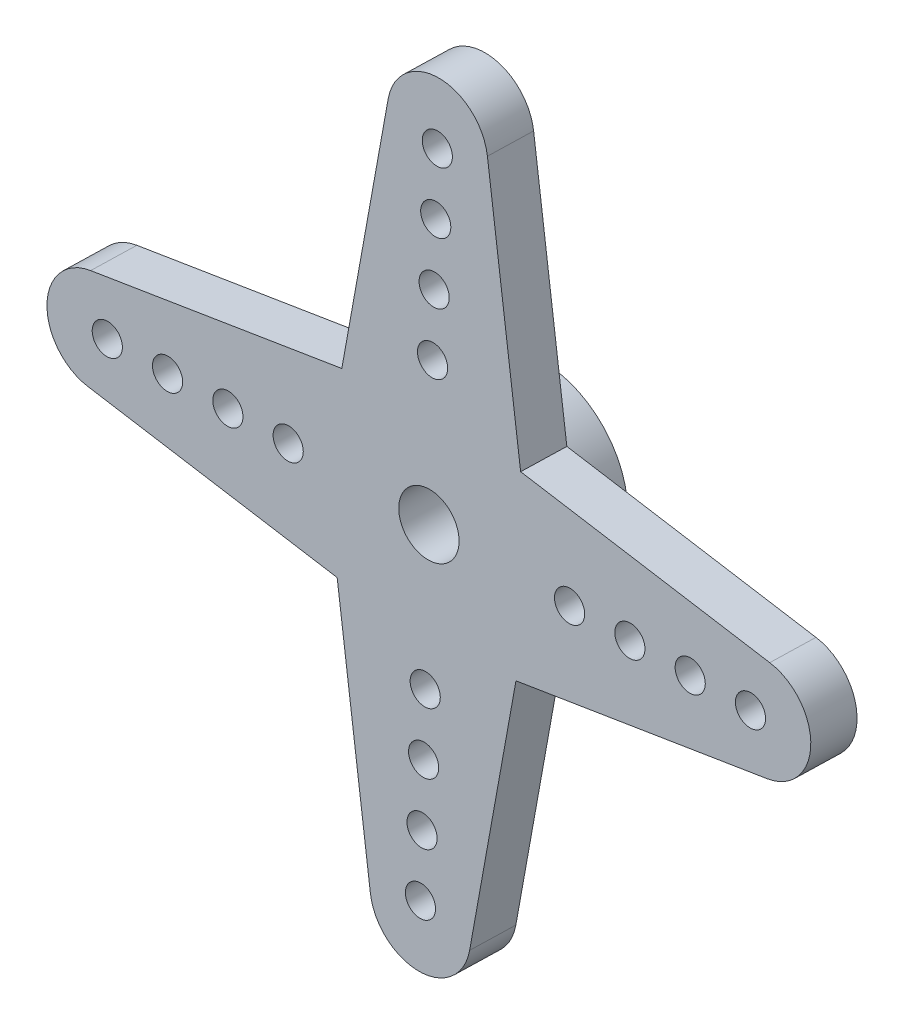
from build123d import *

# Parameters (mm, degrees)
SKETCH1_R                     = 6.1
SKETCH1_R_2                   = 1.5
BOSS_EXTRUDE1_DEPTH           = 2.3
SKETCH2_R                     = 4.4
SKETCH2_R_2                   = 3
BOSS_EXTRUDE2_DEPTH           = 3.2
BOSS_EXTRUDE3_DEPTH           = 2.3
CIRPATTERN1_COUNT             = 4
BODY_MOVE_COPY1_START         = -18.993489175
BODY_MOVE_COPY1_OUTLINE_W     = 40
BODY_MOVE_COPY1_OUTLINE_H     = 41
BODY_MOVE_COPY1_OUTLINE_R     = 0.75
BODY_MOVE_COPY1_OUTLINE_R_2   = 4.4
BODY_MOVE_COPY1_OUTLINE_R_3   = 3
BODY_MOVE_COPY1_DEPTH         = 19.515475783
BODY_MOVE_COPY1_START_2       = 2.821986608
BODY_MOVE_COPY1_2_OUTLINE_R   = 0.75
BODY_MOVE_COPY1_2_DEPTH       = 16.231709548
BODY_MOVE_COPY1_START_3       = 0.521986608
BODY_MOVE_COPY1_3_OUTLINE_W   = 40
BODY_MOVE_COPY1_3_OUTLINE_H   = 41
BODY_MOVE_COPY1_3_OUTLINE_R   = 0.75
BODY_MOVE_COPY1_3_OUTLINE_R_2 = 1.5
BODY_MOVE_COPY1_3_DEPTH       = 2.3
BODY_MOVE_COPY1_START_4       = -18.933282193
BODY_MOVE_COPY1_4_OUTLINE_R   = 4.4
BODY_MOVE_COPY1_4_OUTLINE_R_2 = 3
BODY_MOVE_COPY1_4_DEPTH       = 16.255268801
BODY_MOVE_COPY1_5_OUTLINE_R   = 0.75
BODY_MOVE_COPY1_5_OUTLINE_R_2 = 1.5
BODY_MOVE_COPY1_5_DEPTH       = 2.3
BODY_MOVE_COPY1_START_5       = -2.678013392
BODY_MOVE_COPY1_6_OUTLINE_R   = 4.4
BODY_MOVE_COPY1_6_OUTLINE_R_2 = 3
BODY_MOVE_COPY1_6_DEPTH       = 3.2


# Read off the part's stored shape, not the designer's step: Body-Move/Copy1
with BuildPart() as part:
    # Sketch1 → Boss-Extrude1 (new body)
    with BuildSketch(Plane(origin=(0, 0, 0), x_dir=(1, 0, 0), z_dir=(0, 1, 0))):
        with Locations(Location((0, 0, 0), (0, 0, 270))):
            Circle(SKETCH1_R)
        with Locations(Location((0, 0, 0), (0, 0, 270))):
            Circle(SKETCH1_R_2, mode=Mode.SUBTRACT)
    extrude(amount=BOSS_EXTRUDE1_DEPTH)

    # Sketch2 → Boss-Extrude2 (add)
    with BuildSketch(Plane(origin=(0, 2.3, 0), x_dir=(1, 0, 0), z_dir=(0, 1, 0))):
        with Locations(Location((0, 0, 0), (0, 0, 270))):
            Circle(SKETCH2_R)
        with Locations(Location((0, 0, 0), (0, 0, 270))):
            Circle(SKETCH2_R_2, mode=Mode.SUBTRACT)
    extrude(amount=BOSS_EXTRUDE2_DEPTH)

    # Sketch3 → Boss-Extrude3 (add)
    with BuildSketch(Plane.XZ):
        with BuildLine():
            ThreePointArc((4.5, -4.118252056), (2.458522163, -5.582622034), (0, -6.1))
            Line((0, -6.1), (0, -6.25))
            ThreePointArc((0, -6.25), (0.530330086, -6.469669914), (0.75, -7))
            ThreePointArc((0.75, -7), (0.530330086, -7.530330086), (0, -7.75))
            Line((0, -7.75), (0, -9.25))
            ThreePointArc((0, -9.25), (0.530330086, -9.469669914), (0.75, -10))
            ThreePointArc((0.75, -10), (0.530330086, -10.530330086), (0, -10.75))
            Line((0, -10.75), (0, -12.25))
            ThreePointArc((0, -12.25), (0.530330086, -12.469669914), (0.75, -13))
            ThreePointArc((0.75, -13), (0.530330086, -13.530330086), (0, -13.75))
            Line((0, -13.75), (0, -15.25))
            ThreePointArc((0, -15.25), (0.530330086, -15.469669914), (0.75, -16))
            ThreePointArc((0.75, -16), (0.530330086, -16.530330086), (0, -16.75))
            Line((0, -16.75), (0, -19))
            ThreePointArc((0, -19), (1.623056726, -18.401495955), (2.468988638, -16.892549493))
            Line((2.468988638, -16.892549493), (4.5, -4.118252056))
        make_face()
        with BuildLine():
            Line((0, -6.25), (0, -6.1))
            ThreePointArc((0, -6.1), (-2.458522163, -5.582622034), (-4.5, -4.118252056))
            Line((-4.5, -4.118252056), (-2.468988638, -16.892549493))
            ThreePointArc((-2.468988638, -16.892549493), (-1.623056726, -18.401495955), (0, -19))
            Line((0, -19), (0, -16.75))
            ThreePointArc((0, -16.75), (-0.75, -16), (0, -15.25))
            Line((0, -15.25), (0, -13.75))
            ThreePointArc((0, -13.75), (-0.75, -13), (0, -12.25))
            Line((0, -12.25), (0, -10.75))
            ThreePointArc((0, -10.75), (-0.75, -10), (0, -9.25))
            Line((0, -9.25), (0, -7.75))
            ThreePointArc((0, -7.75), (-0.75, -7), (0, -6.25))
        make_face()
    boss_extrude3 = extrude(amount=-BOSS_EXTRUDE3_DEPTH)

    # CirPattern1: Boss-Extrude3 ×4 about axis
    cirpattern1_axis = Axis((0, 0, 0), (0, 1, 0))
    for i in range(1, CIRPATTERN1_COUNT):
        add(boss_extrude3.rotate(cirpattern1_axis, i * 360 / CIRPATTERN1_COUNT))

    # Body-Move/Copy1 outline → Body-Move/Copy1 (cut)
    # profile 1 of 2: a face of its own
    with BuildSketch(Plane(origin=(0, 0, 0), x_dir=(1, 0, 0), z_dir=(0, 0.02617694830698272, 0.9996573249755807)).offset(BODY_MOVE_COPY1_START)):
        with Locations((0, 2.5)):
            Rectangle(BODY_MOVE_COPY1_OUTLINE_W, BODY_MOVE_COPY1_OUTLINE_H)
        with Locations((0, -13.250942356)):
            Circle(BODY_MOVE_COPY1_OUTLINE_R, mode=Mode.SUBTRACT)
        with Locations((0, -10.250942356)):
            Circle(BODY_MOVE_COPY1_OUTLINE_R, mode=Mode.SUBTRACT)
        with Locations((0, -7.250942356)):
            Circle(BODY_MOVE_COPY1_OUTLINE_R, mode=Mode.SUBTRACT)
        with Locations((0, -4.250942356)):
            Circle(BODY_MOVE_COPY1_OUTLINE_R, mode=Mode.SUBTRACT)
        with Locations((0, 2.749057644)):
            Circle(BODY_MOVE_COPY1_OUTLINE_R_2, mode=Mode.SUBTRACT)
        with Locations((0, 9.749057644)):
            Circle(BODY_MOVE_COPY1_OUTLINE_R, mode=Mode.SUBTRACT)
        with Locations((0, 12.749057644)):
            Circle(BODY_MOVE_COPY1_OUTLINE_R, mode=Mode.SUBTRACT)
        with Locations((0, 15.749057644)):
            Circle(BODY_MOVE_COPY1_OUTLINE_R, mode=Mode.SUBTRACT)
        with Locations((0, 18.749057644)):
            Circle(BODY_MOVE_COPY1_OUTLINE_R, mode=Mode.SUBTRACT)
    # profile 2 of 2: a face of its own
    with BuildSketch(Plane(origin=(0, 0, 0), x_dir=(1, 0, 0), z_dir=(0, 0.02617694830698272, 0.9996573249755807)).offset(BODY_MOVE_COPY1_START)):
        with Locations((0, 2.749057644)):
            Circle(BODY_MOVE_COPY1_OUTLINE_R_3)
    extrude(amount=BODY_MOVE_COPY1_DEPTH, mode=Mode.SUBTRACT)

    # Body-Move_Copy1 2 outline → Body-Move_Copy1 2 (cut)
    with BuildSketch(Plane(origin=(0, 0, 0), x_dir=(1, 0, 0), z_dir=(0, 0.02617694830698272, 0.9996573249755807)).offset(BODY_MOVE_COPY1_START_2)):
        with BuildLine():
            ThreePointArc((-2.468988638, -14.143491849), (0, -16.250942356), (2.468988638, -14.143491849))
            Line((2.468988638, -14.143491849), (4.447631325, -1.698573681))
            Line((4.447631325, -1.698573681), (16.892549493, 0.280069005))
            ThreePointArc((16.892549493, 0.280069005), (19, 2.749057644), (16.892549493, 5.218046282))
            Line((16.892549493, 5.218046282), (4.447631325, 7.196688968))
            Line((4.447631325, 7.196688968), (2.468988638, 19.641607136))
            ThreePointArc((2.468988638, 19.641607136), (0, 21.749057644), (-2.468988638, 19.641607136))
            Line((-2.468988638, 19.641607136), (-4.447631325, 7.196688968))
            Line((-4.447631325, 7.196688968), (-16.892549493, 5.218046282))
            ThreePointArc((-16.892549493, 5.218046282), (-19, 2.749057644), (-16.892549493, 0.280069005))
            Line((-16.892549493, 0.280069005), (-4.447631325, -1.698573681))
            Line((-4.447631325, -1.698573681), (-2.468988638, -14.143491849))
        make_face()
        with Locations((0, -13.250942356)):
            Circle(BODY_MOVE_COPY1_2_OUTLINE_R, mode=Mode.SUBTRACT)
        with Locations((0, -10.250942356)):
            Circle(BODY_MOVE_COPY1_2_OUTLINE_R, mode=Mode.SUBTRACT)
        with Locations((0, -7.250942356)):
            Circle(BODY_MOVE_COPY1_2_OUTLINE_R, mode=Mode.SUBTRACT)
        with Locations((0, -4.250942356)):
            Circle(BODY_MOVE_COPY1_2_OUTLINE_R, mode=Mode.SUBTRACT)
        with Locations((-16, 2.749057644)):
            Circle(BODY_MOVE_COPY1_2_OUTLINE_R, mode=Mode.SUBTRACT)
        with Locations((0, 9.749057644)):
            Circle(BODY_MOVE_COPY1_2_OUTLINE_R, mode=Mode.SUBTRACT)
        with Locations((0, 12.749057644)):
            Circle(BODY_MOVE_COPY1_2_OUTLINE_R, mode=Mode.SUBTRACT)
        with Locations((16, 2.749057644)):
            Circle(BODY_MOVE_COPY1_2_OUTLINE_R, mode=Mode.SUBTRACT)
        with Locations((0, 15.749057644)):
            Circle(BODY_MOVE_COPY1_2_OUTLINE_R, mode=Mode.SUBTRACT)
        with Locations((0, 18.749057644)):
            Circle(BODY_MOVE_COPY1_2_OUTLINE_R, mode=Mode.SUBTRACT)
    extrude(amount=BODY_MOVE_COPY1_2_DEPTH, mode=Mode.SUBTRACT)

    # Body-Move_Copy1 3 outline → Body-Move_Copy1 3 (cut)
    # profile 1 of 10: a face of its own
    with BuildSketch(Plane(origin=(0, 0, 0), x_dir=(1, 0, 0), z_dir=(0, 0.02617694830698272, 0.9996573249755807)).offset(BODY_MOVE_COPY1_START_3)):
        with Locations((0, 2.5)):
            Rectangle(BODY_MOVE_COPY1_3_OUTLINE_W, BODY_MOVE_COPY1_3_OUTLINE_H)
        with BuildLine():
            Line((4.447631325, -1.698573681), (2.468988638, -14.143491849))
            ThreePointArc((2.468988638, -14.143491849), (0, -16.250942356), (-2.468988638, -14.143491849))
            Line((-2.468988638, -14.143491849), (-4.447631325, -1.698573681))
            Line((-4.447631325, -1.698573681), (-16.892549493, 0.280069005))
            ThreePointArc((-16.892549493, 0.280069005), (-19, 2.749057644), (-16.892549493, 5.218046282))
            Line((-16.892549493, 5.218046282), (-4.447631325, 7.196688968))
            Line((-4.447631325, 7.196688968), (-2.468988638, 19.641607136))
            ThreePointArc((-2.468988638, 19.641607136), (0, 21.749057644), (2.468988638, 19.641607136))
            Line((2.468988638, 19.641607136), (4.447631325, 7.196688968))
            Line((4.447631325, 7.196688968), (16.892549493, 5.218046282))
            ThreePointArc((16.892549493, 5.218046282), (19, 2.749057644), (16.892549493, 0.280069005))
            Line((16.892549493, 0.280069005), (4.447631325, -1.698573681))
        make_face(mode=Mode.SUBTRACT)
    # profile 2 of 10: a face of its own
    with BuildSketch(Plane(origin=(0, 0, 0), x_dir=(1, 0, 0), z_dir=(0, 0.02617694830698272, 0.9996573249755807)).offset(BODY_MOVE_COPY1_START_3)):
        with Locations((-7, 2.749057644)):
            Circle(BODY_MOVE_COPY1_3_OUTLINE_R)
    # profile 3 of 10: a face of its own
    with BuildSketch(Plane(origin=(0, 0, 0), x_dir=(1, 0, 0), z_dir=(0, 0.02617694830698272, 0.9996573249755807)).offset(BODY_MOVE_COPY1_START_3)):
        with Locations((-10, 2.749057644)):
            Circle(BODY_MOVE_COPY1_3_OUTLINE_R)
    # profile 4 of 10: a face of its own
    with BuildSketch(Plane(origin=(0, 0, 0), x_dir=(1, 0, 0), z_dir=(0, 0.02617694830698272, 0.9996573249755807)).offset(BODY_MOVE_COPY1_START_3)):
        with Locations((-13, 2.749057644)):
            Circle(BODY_MOVE_COPY1_3_OUTLINE_R)
    # profile 5 of 10: a face of its own
    with BuildSketch(Plane(origin=(0, 0, 0), x_dir=(1, 0, 0), z_dir=(0, 0.02617694830698272, 0.9996573249755807)).offset(BODY_MOVE_COPY1_START_3)):
        with Locations((-16, 2.749057644)):
            Circle(BODY_MOVE_COPY1_3_OUTLINE_R)
    # profile 6 of 10: a face of its own
    with BuildSketch(Plane(origin=(0, 0, 0), x_dir=(1, 0, 0), z_dir=(0, 0.02617694830698272, 0.9996573249755807)).offset(BODY_MOVE_COPY1_START_3)):
        with Locations((7, 2.749057644)):
            Circle(BODY_MOVE_COPY1_3_OUTLINE_R)
    # profile 7 of 10: a face of its own
    with BuildSketch(Plane(origin=(0, 0, 0), x_dir=(1, 0, 0), z_dir=(0, 0.02617694830698272, 0.9996573249755807)).offset(BODY_MOVE_COPY1_START_3)):
        with Locations((10, 2.749057644)):
            Circle(BODY_MOVE_COPY1_3_OUTLINE_R)
    # profile 8 of 10: a face of its own
    with BuildSketch(Plane(origin=(0, 0, 0), x_dir=(1, 0, 0), z_dir=(0, 0.02617694830698272, 0.9996573249755807)).offset(BODY_MOVE_COPY1_START_3)):
        with Locations((13, 2.749057644)):
            Circle(BODY_MOVE_COPY1_3_OUTLINE_R)
    # profile 9 of 10: a face of its own
    with BuildSketch(Plane(origin=(0, 0, 0), x_dir=(1, 0, 0), z_dir=(0, 0.02617694830698272, 0.9996573249755807)).offset(BODY_MOVE_COPY1_START_3)):
        with Locations((16, 2.749057644)):
            Circle(BODY_MOVE_COPY1_3_OUTLINE_R)
    # profile 10 of 10: a face of its own
    with BuildSketch(Plane(origin=(0, 0, 0), x_dir=(1, 0, 0), z_dir=(0, 0.02617694830698272, 0.9996573249755807)).offset(BODY_MOVE_COPY1_START_3)):
        with Locations((0, 2.749057644)):
            Circle(BODY_MOVE_COPY1_3_OUTLINE_R_2)
    extrude(amount=BODY_MOVE_COPY1_3_DEPTH, mode=Mode.SUBTRACT)

    # Body-Move_Copy1 4 outline → Body-Move_Copy1 4 (cut)
    with BuildSketch(Plane(origin=(0, 0, 0), x_dir=(1, 0, 0), z_dir=(0, 0.02617694830698272, 0.9996573249755807)).offset(BODY_MOVE_COPY1_START_4)):
        with Locations((0, 2.749057644)):
            Circle(BODY_MOVE_COPY1_4_OUTLINE_R)
        with Locations((0, 2.749057644)):
            Circle(BODY_MOVE_COPY1_4_OUTLINE_R_2, mode=Mode.SUBTRACT)
    extrude(amount=BODY_MOVE_COPY1_4_DEPTH, mode=Mode.SUBTRACT)

    # Body-Move_Copy1 5 outline → Body-Move_Copy1 5 (add)
    with BuildSketch(Plane(origin=(0, 0, 0), x_dir=(1, 0, 0), z_dir=(0, 0.02617694830698272, 0.9996573249755807)).offset(BODY_MOVE_COPY1_START_3)):
        with BuildLine():
            ThreePointArc((-2.468988638, -14.143491849), (0, -16.250942356), (2.468988638, -14.143491849))
            Line((2.468988638, -14.143491849), (4.447631325, -1.698573681))
            Line((4.447631325, -1.698573681), (16.892549493, 0.280069005))
            ThreePointArc((16.892549493, 0.280069005), (19, 2.749057644), (16.892549493, 5.218046282))
            Line((16.892549493, 5.218046282), (4.447631325, 7.196688968))
            Line((4.447631325, 7.196688968), (2.468988638, 19.641607136))
            ThreePointArc((2.468988638, 19.641607136), (0, 21.749057644), (-2.468988638, 19.641607136))
            Line((-2.468988638, 19.641607136), (-4.447631325, 7.196688968))
            Line((-4.447631325, 7.196688968), (-16.892549493, 5.218046282))
            ThreePointArc((-16.892549493, 5.218046282), (-19, 2.749057644), (-16.892549493, 0.280069005))
            Line((-16.892549493, 0.280069005), (-4.447631325, -1.698573681))
            Line((-4.447631325, -1.698573681), (-2.468988638, -14.143491849))
        make_face()
        with Locations((0, -13.250942356)):
            Circle(BODY_MOVE_COPY1_5_OUTLINE_R, mode=Mode.SUBTRACT)
        with Locations((0, -10.250942356)):
            Circle(BODY_MOVE_COPY1_5_OUTLINE_R, mode=Mode.SUBTRACT)
        with Locations((0, -7.250942356)):
            Circle(BODY_MOVE_COPY1_5_OUTLINE_R, mode=Mode.SUBTRACT)
        with Locations((0, -4.250942356)):
            Circle(BODY_MOVE_COPY1_5_OUTLINE_R, mode=Mode.SUBTRACT)
        with Locations((-16, 2.749057644)):
            Circle(BODY_MOVE_COPY1_5_OUTLINE_R, mode=Mode.SUBTRACT)
        with Locations((-13, 2.749057644)):
            Circle(BODY_MOVE_COPY1_5_OUTLINE_R, mode=Mode.SUBTRACT)
        with Locations((-10, 2.749057644)):
            Circle(BODY_MOVE_COPY1_5_OUTLINE_R, mode=Mode.SUBTRACT)
        with Locations((-7, 2.749057644)):
            Circle(BODY_MOVE_COPY1_5_OUTLINE_R, mode=Mode.SUBTRACT)
        with Locations((7, 2.749057644)):
            Circle(BODY_MOVE_COPY1_5_OUTLINE_R, mode=Mode.SUBTRACT)
        with Locations((0, 9.749057644)):
            Circle(BODY_MOVE_COPY1_5_OUTLINE_R, mode=Mode.SUBTRACT)
        with Locations((0, 12.749057644)):
            Circle(BODY_MOVE_COPY1_5_OUTLINE_R, mode=Mode.SUBTRACT)
        with Locations((10, 2.749057644)):
            Circle(BODY_MOVE_COPY1_5_OUTLINE_R, mode=Mode.SUBTRACT)
        with Locations((13, 2.749057644)):
            Circle(BODY_MOVE_COPY1_5_OUTLINE_R, mode=Mode.SUBTRACT)
        with Locations((16, 2.749057644)):
            Circle(BODY_MOVE_COPY1_5_OUTLINE_R, mode=Mode.SUBTRACT)
        with Locations((0, 15.749057644)):
            Circle(BODY_MOVE_COPY1_5_OUTLINE_R, mode=Mode.SUBTRACT)
        with Locations((0, 18.749057644)):
            Circle(BODY_MOVE_COPY1_5_OUTLINE_R, mode=Mode.SUBTRACT)
        with Locations((0, 2.749057644)):
            Circle(BODY_MOVE_COPY1_5_OUTLINE_R_2, mode=Mode.SUBTRACT)
    extrude(amount=BODY_MOVE_COPY1_5_DEPTH)

    # Body-Move_Copy1 6 outline → Body-Move_Copy1 6 (add)
    with BuildSketch(Plane(origin=(0, 0, 0), x_dir=(1, 0, 0), z_dir=(0, 0.02617694830698272, 0.9996573249755807)).offset(BODY_MOVE_COPY1_START_5)):
        with Locations((0, 2.749057644)):
            Circle(BODY_MOVE_COPY1_6_OUTLINE_R)
        with Locations((0, 2.749057644)):
            Circle(BODY_MOVE_COPY1_6_OUTLINE_R_2, mode=Mode.SUBTRACT)
    extrude(amount=BODY_MOVE_COPY1_6_DEPTH)


solid = part.part
